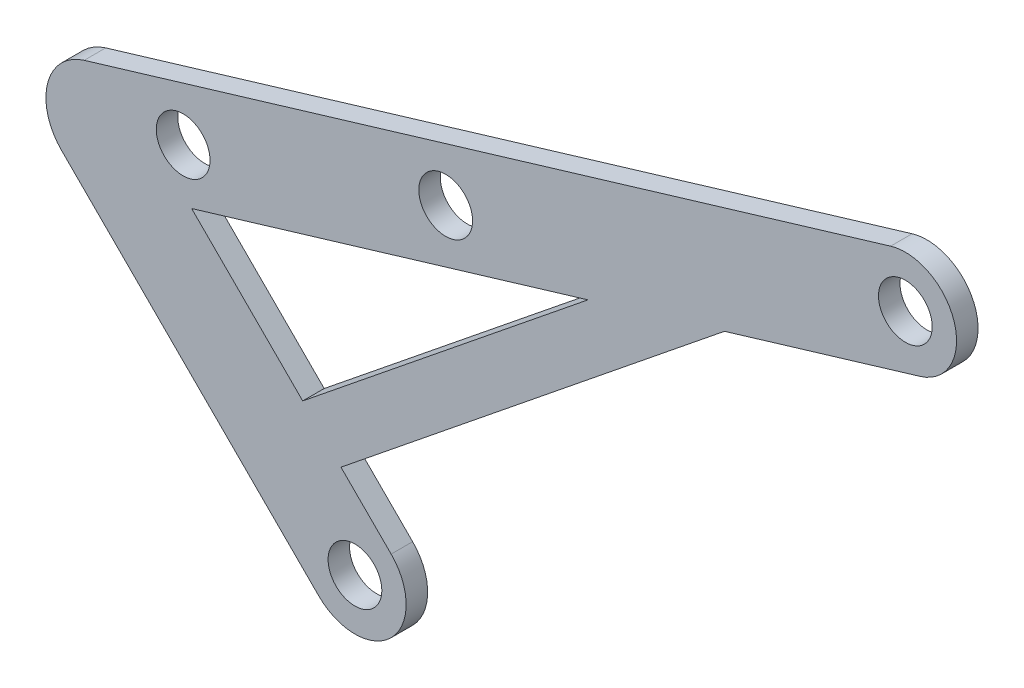
from build123d import *

# Parameters (mm, degrees)
SKETCH2_R           = 5
BOSS_EXTRUDE3_DEPTH = 4
FILLET3_R           = 10
SKETCH5_R           = 5
CUT_EXTRUDE3_DEPTH  = 4


with BuildPart() as part:
    # Sketch2 → Boss-Extrude3 (new body)
    with BuildSketch(Plane.XY):
        with BuildLine():
            ThreePointArc((-91.435459064, 0), (-77.965074882, 0), (-77.965074882, 13.470384182))
            Line((-77.965074882, 13.470384182), (-87.300193609, 22.805502909))
            Line((-87.300193609, 22.805502909), (-15.947819408, 80.372818981))
            Line((-15.947819408, 80.372818981), (20.440179007, 91.304613549))
            ThreePointArc((20.440179007, 91.304613549), (26.821882285, 103.16737517), (14.959120664, 109.549078448))
            Line((14.959120664, 109.549078448), (-151.097343154, 59.661884091))
            Line((-151.097343154, 59.661884091), (-91.435459064, 0))
        make_face()
        Polygon((-115.084548239, 50.589857539), (-41.344385101, 72.743104488), (-94.417910685, 29.923219984), align=None, mode=Mode.SUBTRACT)
        with Locations((-84.700266973, 6.735192091)):
            Circle(SKETCH2_R, mode=Mode.SUBTRACT)
        with Locations((17.699649835, 100.426845999)):
            Circle(SKETCH2_R, mode=Mode.SUBTRACT)
    extrude(amount=BOSS_EXTRUDE3_DEPTH)

    # Fillet3
    fillet3_edges = [part.edges().sort_by_distance(p)[0] for p in [
        (-151.097343154, 59.661884091, 2),
    ]]
    fillet(fillet3_edges, radius=FILLET3_R)

    # Sketch5 → Cut-Extrude3 (cut)
    with BuildSketch(Plane.XY.offset(4)):
        with Locations((-116.663330616, 60.061105539)):
            Circle(SKETCH5_R)
        with Locations((-67.81988128, 74.734805039)):
            Circle(SKETCH5_R)
    extrude(amount=-CUT_EXTRUDE3_DEPTH, mode=Mode.SUBTRACT)


solid = part.part
